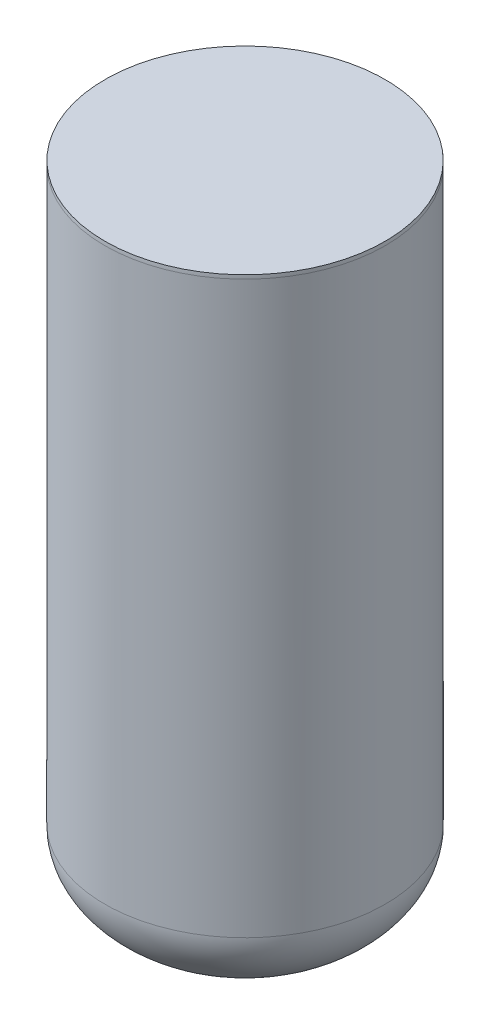
from build123d import *

# Parameters (mm, degrees)
SKETCH2_R                = 95.25
BOSS_EXTRUDE1_DEPTH      = 387.35
F_7_START                = -57.15
SKETCH6_R                = 95.25
F_7_PERCENT_ULLAGE_DEPTH = 57.15


with BuildPart() as part:
    # Sketch2 → Boss-Extrude1 (new body)
    with BuildSketch(Plane(origin=(0, 0, 0), x_dir=(1, 0, 0), z_dir=(0, 1, 0))):
        Circle(SKETCH2_R)
    extrude(amount=BOSS_EXTRUDE1_DEPTH)

    # Sketch3 → Revolve2 (revolve)
    with BuildSketch(Plane(origin=(0, 0, 0), x_dir=(0, 0, -1), z_dir=(1, 0, 0))):
        with BuildLine():
            Line((0, 447.04), (0, 387.35))
            Line((0, 387.35), (95.25, 387.35))
            add(Edge.make_bspline(
                [(95.25, 387.35), (95.25, 447.04), (0, 447.04)],
                knots=[3.141592654, 3.141592654, 3.141592654, 4.71238898, 4.71238898, 4.71238898], degree=2, weights=[1, 0.707106781, 1]))
        make_face()
    revolve(axis=Axis((0, 447.04, 0), (0, -1, 0)))

    # Sketch4 → Revolve3 (revolve)
    with BuildSketch(Plane(origin=(0, 0, 0), x_dir=(0, 0, -1), z_dir=(1, 0, 0))):
        with BuildLine():
            Line((0, -61.214), (0, 0))
            Line((0, 0), (95.25, 0))
            add(Edge.make_bspline(
                [(0, -61.214), (95.25, -61.214), (95.25, 0)],
                knots=[4.71238898, 4.71238898, 4.71238898, 6.283185307, 6.283185307, 6.283185307], degree=2, weights=[1, 0.707106781, 1]))
        make_face()
    revolve(axis=Axis((0, -61.214, 0), (0, 1, 0)))

    # Sketch6 → 7 Percent Ullage (cut)
    with BuildSketch(Plane(origin=(0, 447.04, 0), x_dir=(1, 0, 0), z_dir=(0, 1, 0)).offset(F_7_START)):
        Circle(SKETCH6_R)
    extrude(amount=F_7_PERCENT_ULLAGE_DEPTH, mode=Mode.SUBTRACT)


solid = part.part
